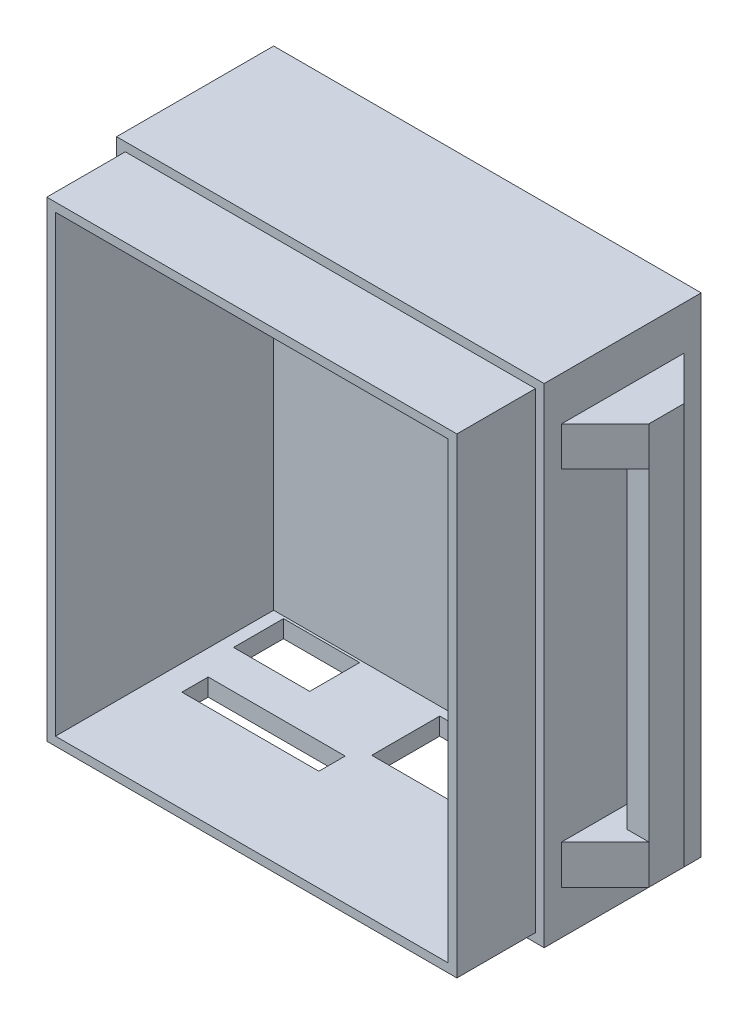
from build123d import *

# Parameters (mm, degrees)
SCHIZZO1_W                    = 49
SCHIZZO1_H                    = 56
ESTRUSIONE_ESTRUSIONE1_DEPTH  = 2
SCHIZZO3_W                    = 49
SCHIZZO3_H                    = 2
ESTRUSIONE_ESTRUSIONE2_DEPTH  = 25
SCHIZZO4_W                    = 2
SCHIZZO4_H                    = 54
ESTRUSIONE_ESTRUSIONE3_DEPTH  = 25
SCHIZZO5_W                    = 47
SCHIZZO5_H                    = 2
ESTRUSIONE_ESTRUSIONE4_DEPTH  = 25
SCHIZZO6_W                    = 2
SCHIZZO6_H                    = 52
ESTRUSIONE_ESTRUSIONE5_DEPTH  = 25
SCHIZZO7_W                    = 25
SCHIZZO7_H                    = 3
ESTRUSIONE_ESTRUSIONE6_DEPTH  = 13.3
SCHIZZO9_W                    = 3.5
SCHIZZO9_H                    = 52
ESTRUSIONE_ESTRUSIONE7_DEPTH  = 13.3
SCHIZZO10_W                   = 4
SCHIZZO10_H                   = 1.5
TAGLIO_ESTRUSIONE1_DEPTH      = 6
SCHIZZO11_W                   = 1.5
SCHIZZO11_H                   = 1.5
TAGLIO_ESTRUSIONE2_DEPTH      = 6
SCHIZZO12_W                   = 4
SCHIZZO12_H                   = 1
TAGLIO_ESTRUSIONE3_DEPTH      = 0.75
SCHIZZO13_W                   = 4
SCHIZZO13_H                   = 1
TAGLIO_ESTRUSIONE4_DEPTH      = 0.75
SCHIZZO14_W                   = 4
SCHIZZO14_H                   = 1
TAGLIO_ESTRUSIONE5_DEPTH      = 0.75
SCHIZZO15_W                   = 4
SCHIZZO15_H                   = 1
TAGLIO_ESTRUSIONE6_DEPTH      = 0.75
SCHIZZO21_W                   = 1
SCHIZZO21_H                   = 1.5
TAGLIO_ESTRUSIONE7_DEPTH      = 1
SCHIZZO23_W                   = 2.5
SCHIZZO23_H                   = 0.75
TAGLIO_ESTRUSIONE8_DEPTH      = 1
SCHIZZO24_W                   = 2.496840505
SCHIZZO24_H                   = 0.75
TAGLIO_ESTRUSIONE9_DEPTH      = 1
SCHIZZO26_W                   = 1.003159495
SCHIZZO26_H                   = 3
TAGLIO_ESTRUSIONE10_DEPTH     = 1
SCHIZZO27_W                   = 1
SCHIZZO27_H                   = 3
TAGLIO_ESTRUSIONE11_DEPTH     = 1
SCHIZZO28_W                   = 3.5
SCHIZZO28_H                   = 4
TAGLIO_ESTRUSIONE12_DEPTH     = 1
SCHIZZO33_W                   = 3.5
SCHIZZO33_H                   = 4
TAGLIO_ESTRUSIONE16_DEPTH     = 1
SCHIZZO34_W                   = 8.724662476
SCHIZZO34_H                   = 5.720773809
TAGLIO_ESTRUSIONE17_DEPTH     = 2
SCHIZZO36_W                   = 18.231331737
SCHIZZO36_H                   = 7.790205668
TAGLIO_ESTRUSIONE18_DEPTH     = 2
SCHIZZO37_W                   = 15.695031374
SCHIZZO37_H                   = 3.015147161
TAGLIO_ESTRUSIONE19_DEPTH     = 2
SCHIZZO38_W                   = 1
SCHIZZO38_H                   = 56
TAGLIO_ESTRUSIONE20_DEPTH     = 9
SCHIZZO39_W                   = 48
SCHIZZO39_H                   = 1
TAGLIO_ESTRUSIONE21_DEPTH     = 9
SCHIZZO40_W                   = 1
SCHIZZO40_H                   = 55
TAGLIO_ESTRUSIONE22_DEPTH     = 9
SCHIZZO41_W                   = 47
SCHIZZO41_H                   = 1
TAGLIO_ESTRUSIONE23_DEPTH     = 9
SCHIZZO42_W                   = 14
SCHIZZO42_H                   = 4.5
ESTRUSIONE_ESTRUSIONE10_DEPTH = 5
TAGLIO_ESTRUSIONE24_DEPTH     = 6
TAGLIO_ESTRUSIONE25_DEPTH     = 6
SCHIZZO48_W                   = 2.5
SCHIZZO48_H                   = 4
ESTRUSIONE_ESTRUSIONE11_DEPTH = 41.5
SCHIZZO49_W                   = 4
SCHIZZO49_H                   = 4.5
ESTRUSIONE_ESTRUSIONE12_DEPTH = 2.5
SCHIZZO51_W                   = 5
SCHIZZO51_H                   = 4.5
ESTRUSIONE_ESTRUSIONE13_DEPTH = 5
TAGLIO_ESTRUSIONE26_DEPTH     = 5
SCHIZZO53_W                   = 5
SCHIZZO53_H                   = 4.5
ESTRUSIONE_ESTRUSIONE14_DEPTH = 5
TAGLIO_ESTRUSIONE27_DEPTH     = 5
SCHIZZO55_W                   = 14
SCHIZZO55_H                   = 4.5
ESTRUSIONE_ESTRUSIONE15_DEPTH = 5


with BuildPart() as part:
    # Schizzo1 → Estrusione-Estrusione1 (new body)
    with BuildSketch(Plane.XY):
        with Locations((24.5, 28)):
            Rectangle(SCHIZZO1_W, SCHIZZO1_H)
    extrude(amount=ESTRUSIONE_ESTRUSIONE1_DEPTH)

    # Schizzo3 → Estrusione-Estrusione2 (add)
    with BuildSketch(Plane.XY.offset(2)):
        with Locations((24.5, 55)):
            Rectangle(SCHIZZO3_W, SCHIZZO3_H)
    extrude(amount=ESTRUSIONE_ESTRUSIONE2_DEPTH)

    # Schizzo4 → Estrusione-Estrusione3 (add)
    with BuildSketch(Plane.XY.offset(2)):
        with Locations((48, 27)):
            Rectangle(SCHIZZO4_W, SCHIZZO4_H)
    extrude(amount=ESTRUSIONE_ESTRUSIONE3_DEPTH)

    # Schizzo5 → Estrusione-Estrusione4 (add)
    with BuildSketch(Plane.XY.offset(2)):
        with Locations((23.5, 1)):
            Rectangle(SCHIZZO5_W, SCHIZZO5_H)
    extrude(amount=ESTRUSIONE_ESTRUSIONE4_DEPTH)

    # Schizzo6 → Estrusione-Estrusione5 (add)
    with BuildSketch(Plane.XY.offset(2)):
        with Locations((1, 28)):
            Rectangle(SCHIZZO6_W, SCHIZZO6_H)
    extrude(amount=ESTRUSIONE_ESTRUSIONE5_DEPTH)

    # Schizzo7 → Estrusione-Estrusione6 (add)
    with BuildSketch(Plane.XY.offset(2)):
        with Locations((14.5, 45.2)):
            Rectangle(SCHIZZO7_W, SCHIZZO7_H)
    extrude(amount=ESTRUSIONE_ESTRUSIONE6_DEPTH)

    # Schizzo9 → Estrusione-Estrusione7 (add)
    with BuildSketch(Plane.XY.offset(2)):
        with Locations((45.25, 28)):
            Rectangle(SCHIZZO9_W, SCHIZZO9_H)
    extrude(amount=ESTRUSIONE_ESTRUSIONE7_DEPTH)

    # Schizzo10 → Taglio-Estrusione1 (cut)
    with BuildSketch(Plane.XY.offset(15.3)):
        with Locations((6, 45.2)):
            Rectangle(SCHIZZO10_W, SCHIZZO10_H)
        with Locations((24, 45.2)):
            Rectangle(SCHIZZO10_W, SCHIZZO10_H)
    extrude(amount=-TAGLIO_ESTRUSIONE1_DEPTH, mode=Mode.SUBTRACT)

    # Schizzo11 → Taglio-Estrusione2 (cut)
    with BuildSketch(Plane.XY.offset(15.3)):
        with Locations((45.25, 45.2)):
            Rectangle(SCHIZZO11_W, SCHIZZO11_H)
    extrude(amount=-TAGLIO_ESTRUSIONE2_DEPTH, mode=Mode.SUBTRACT)

    # Schizzo12 → Taglio-Estrusione3 (cut)
    with BuildSketch(Plane(origin=(0, 45.95, 0), x_dir=(-1, 0, 0), z_dir=(0, -1, 0))):
        with Locations((-6, -14.8)):
            Rectangle(SCHIZZO12_W, SCHIZZO12_H)
    extrude(amount=-TAGLIO_ESTRUSIONE3_DEPTH, mode=Mode.SUBTRACT)

    # Schizzo13 → Taglio-Estrusione4 (cut)
    with BuildSketch(Plane(origin=(0, 44.45, 0), x_dir=(1, 0, 0), z_dir=(0, 1, 0))):
        with Locations((6, -14.8)):
            Rectangle(SCHIZZO13_W, SCHIZZO13_H)
    extrude(amount=-TAGLIO_ESTRUSIONE4_DEPTH, mode=Mode.SUBTRACT)

    # Schizzo14 → Taglio-Estrusione5 (cut)
    with BuildSketch(Plane(origin=(0, 45.95, 0), x_dir=(-1, 0, 0), z_dir=(0, -1, 0))):
        with Locations((-24, -14.8)):
            Rectangle(SCHIZZO14_W, SCHIZZO14_H)
    extrude(amount=-TAGLIO_ESTRUSIONE5_DEPTH, mode=Mode.SUBTRACT)

    # Schizzo15 → Taglio-Estrusione6 (cut)
    with BuildSketch(Plane(origin=(0, 44.45, 0), x_dir=(1, 0, 0), z_dir=(0, 1, 0))):
        with Locations((24, -14.8)):
            Rectangle(SCHIZZO15_W, SCHIZZO15_H)
    extrude(amount=-TAGLIO_ESTRUSIONE6_DEPTH, mode=Mode.SUBTRACT)

    # Schizzo21 → Taglio-Estrusione7 (cut)
    with BuildSketch(Plane.XY.offset(15.3)):
        with Locations((44, 45.2)):
            Rectangle(SCHIZZO21_W, SCHIZZO21_H)
    extrude(amount=-TAGLIO_ESTRUSIONE7_DEPTH, mode=Mode.SUBTRACT)

    # Schizzo23 → Taglio-Estrusione8 (cut)
    with BuildSketch(Plane.XY.offset(15.3)):
        with Locations((44.75, 46.325)):
            Rectangle(SCHIZZO23_W, SCHIZZO23_H)
    extrude(amount=-TAGLIO_ESTRUSIONE8_DEPTH, mode=Mode.SUBTRACT)

    # Schizzo24 → Taglio-Estrusione9 (cut)
    with BuildSketch(Plane.XY.offset(15.3)):
        with Locations((44.748420252, 44.075)):
            Rectangle(SCHIZZO24_W, SCHIZZO24_H)
    extrude(amount=-TAGLIO_ESTRUSIONE9_DEPTH, mode=Mode.SUBTRACT)

    # Schizzo26 → Taglio-Estrusione10 (cut)
    with BuildSketch(Plane.XY.offset(15.3)):
        with Locations((46.498420252, 45.2)):
            Rectangle(SCHIZZO26_W, SCHIZZO26_H)
    extrude(amount=-TAGLIO_ESTRUSIONE10_DEPTH, mode=Mode.SUBTRACT)

    # Schizzo27 → Taglio-Estrusione11 (cut)
    with BuildSketch(Plane.XY.offset(15.3)):
        with Locations((26.5, 45.2)):
            Rectangle(SCHIZZO27_W, SCHIZZO27_H)
    extrude(amount=-TAGLIO_ESTRUSIONE11_DEPTH, mode=Mode.SUBTRACT)

    # Schizzo28 → Taglio-Estrusione12 (cut)
    with BuildSketch(Plane.XY.offset(15.3)):
        with Locations((45.25, 15.3)):
            Rectangle(SCHIZZO28_W, SCHIZZO28_H)
    extrude(amount=-TAGLIO_ESTRUSIONE12_DEPTH, mode=Mode.SUBTRACT)

    # Schizzo33 → Taglio-Estrusione16 (cut)
    with BuildSketch(Plane.XY.offset(15.3)):
        with Locations((45.25, 30.5)):
            Rectangle(SCHIZZO33_W, SCHIZZO33_H)
    extrude(amount=-TAGLIO_ESTRUSIONE16_DEPTH, mode=Mode.SUBTRACT)

    # Schizzo34 → Taglio-Estrusione17 (cut)
    with BuildSketch(Plane.XZ):
        with Locations((7.756146884, 5.127413967)):
            Rectangle(SCHIZZO34_W, SCHIZZO34_H)
    extrude(amount=-TAGLIO_ESTRUSIONE17_DEPTH, mode=Mode.SUBTRACT)

    # Schizzo36 → Taglio-Estrusione18 (cut)
    with BuildSketch(Plane.XZ):
        with Locations((31.131385829, 6.880572543)):
            Rectangle(SCHIZZO36_W, SCHIZZO36_H)
    extrude(amount=-TAGLIO_ESTRUSIONE18_DEPTH, mode=Mode.SUBTRACT)

    # Schizzo37 → Taglio-Estrusione19 (cut)
    with BuildSketch(Plane(origin=(0, 0, 0), x_dir=(-1, 0, 0), z_dir=(0, -1, 0))):
        with Locations((-12.721702287, -13.882101195)):
            Rectangle(SCHIZZO37_W, SCHIZZO37_H)
    extrude(amount=-TAGLIO_ESTRUSIONE19_DEPTH, mode=Mode.SUBTRACT)

    # Schizzo38 → Taglio-Estrusione20 (cut)
    with BuildSketch(Plane.XY.offset(27)):
        with Locations((48.5, 28)):
            Rectangle(SCHIZZO38_W, SCHIZZO38_H)
    extrude(amount=-TAGLIO_ESTRUSIONE20_DEPTH, mode=Mode.SUBTRACT)

    # Schizzo39 → Taglio-Estrusione21 (cut)
    with BuildSketch(Plane.XY.offset(27)):
        with Locations((24, 0.5)):
            Rectangle(SCHIZZO39_W, SCHIZZO39_H)
    extrude(amount=-TAGLIO_ESTRUSIONE21_DEPTH, mode=Mode.SUBTRACT)

    # Schizzo40 → Taglio-Estrusione22 (cut)
    with BuildSketch(Plane.XY.offset(27)):
        with Locations((0.5, 28.5)):
            Rectangle(SCHIZZO40_W, SCHIZZO40_H)
    extrude(amount=-TAGLIO_ESTRUSIONE22_DEPTH, mode=Mode.SUBTRACT)

    # Schizzo41 → Taglio-Estrusione23 (cut)
    with BuildSketch(Plane.XY.offset(27)):
        with Locations((24.5, 55.5)):
            Rectangle(SCHIZZO41_W, SCHIZZO41_H)
    extrude(amount=-TAGLIO_ESTRUSIONE23_DEPTH, mode=Mode.SUBTRACT)

    # Schizzo42 → Estrusione-Estrusione10 (add)
    with BuildSketch(Plane(origin=(49, 0, 0), x_dir=(0, 0, -1), z_dir=(1, 0, 0))):
        with Locations((-9, 7.25)):
            Rectangle(SCHIZZO42_W, SCHIZZO42_H)
    extrude(amount=ESTRUSIONE_ESTRUSIONE10_DEPTH)

    # Schizzo44 → Taglio-Estrusione24 (cut)
    with BuildSketch(Plane(origin=(0, 5, 0), x_dir=(-1, 0, 0), z_dir=(0, -1, 0))):
        Polygon((-54, -16), (-54, -11), (-49, -16), align=None)
    extrude(amount=-TAGLIO_ESTRUSIONE24_DEPTH, mode=Mode.SUBTRACT)

    # Schizzo45 → Taglio-Estrusione25 (cut)
    with BuildSketch(Plane(origin=(0, 5, 0), x_dir=(-1, 0, 0), z_dir=(0, -1, 0))):
        Polygon((-54, -2), (-54, -7), (-49, -2), align=None)
    extrude(amount=-TAGLIO_ESTRUSIONE25_DEPTH, mode=Mode.SUBTRACT)

    # Schizzo48 → Estrusione-Estrusione11 (add)
    with BuildSketch(Plane(origin=(0, 9.5, 0), x_dir=(1, 0, 0), z_dir=(0, 1, 0))):
        with Locations((52.75, -9)):
            Rectangle(SCHIZZO48_W, SCHIZZO48_H)
    extrude(amount=ESTRUSIONE_ESTRUSIONE11_DEPTH)

    # Schizzo49 → Estrusione-Estrusione12 (add)
    with BuildSketch(Plane.ZY.offset(-51.5)):
        with Locations((9, 48.75)):
            Rectangle(SCHIZZO49_W, SCHIZZO49_H)
    extrude(amount=ESTRUSIONE_ESTRUSIONE12_DEPTH)

    # Schizzo51 → Estrusione-Estrusione13 (add)
    with BuildSketch(Plane(origin=(49, 0, 0), x_dir=(0, 0, -1), z_dir=(1, 0, 0))):
        with Locations((-4.5, 48.75)):
            Rectangle(SCHIZZO51_W, SCHIZZO51_H)
    extrude(amount=ESTRUSIONE_ESTRUSIONE13_DEPTH)

    # Schizzo52 → Taglio-Estrusione26 (cut)
    with BuildSketch(Plane(origin=(0, 46.5, 0), x_dir=(-1, 0, 0), z_dir=(0, -1, 0))):
        Polygon((-49, -2), (-54, -7), (-54, -2), align=None)
    extrude(amount=-TAGLIO_ESTRUSIONE26_DEPTH, mode=Mode.SUBTRACT)

    # Schizzo53 → Estrusione-Estrusione14 (add)
    with BuildSketch(Plane(origin=(49, 0, 0), x_dir=(0, 0, -1), z_dir=(1, 0, 0))):
        with Locations((-13.5, 48.75)):
            Rectangle(SCHIZZO53_W, SCHIZZO53_H)
    extrude(amount=ESTRUSIONE_ESTRUSIONE14_DEPTH)

    # Schizzo54 → Taglio-Estrusione27 (cut)
    with BuildSketch(Plane(origin=(0, 46.5, 0), x_dir=(-1, 0, 0), z_dir=(0, -1, 0))):
        Polygon((-49, -16), (-54, -11), (-54, -16), align=None)
    extrude(amount=-TAGLIO_ESTRUSIONE27_DEPTH, mode=Mode.SUBTRACT)

    # Schizzo55 → Estrusione-Estrusione15 (add)
    with BuildSketch(Plane.ZY):
        with Locations((9, 7.25)):
            Rectangle(SCHIZZO55_W, SCHIZZO55_H)
    extrude(amount=ESTRUSIONE_ESTRUSIONE15_DEPTH)


solid = part.part
